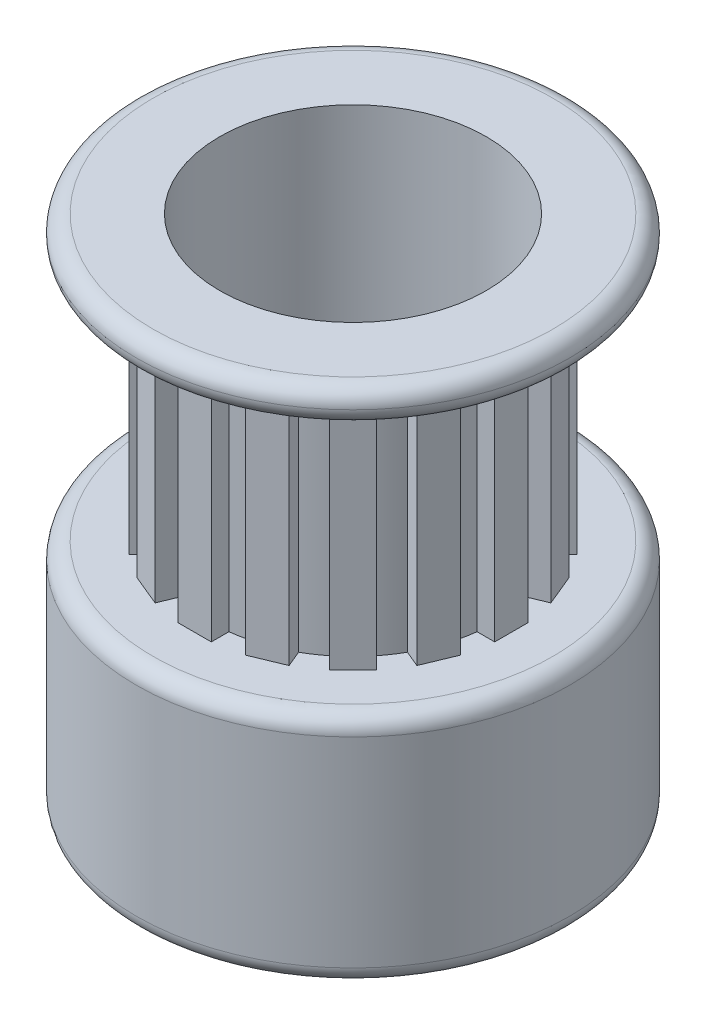
from build123d import *

# Parameters (mm, degrees)
SKETCH_3_R          = 4000
EXTRUDE_1_DEPTH     = 7500
SKETCH_4_R          = 6500
SKETCH_4_R_2        = 4000
EXTRUDE_2_DEPTH     = 1000
EXTRUDE_START       = 7000
SKETCH_5_R          = 6500
SKETCH_5_R_2        = 4000
EXTRUDE_3_DEPTH     = 7000
FILLET_1_R          = 500
FILLET_2_R          = 500
SKETCH_6_R          = 1500
CUT_EXTRUDE_1_DEPTH = 7000


with BuildPart() as part:
    # 草圖3 → 填料-伸長1 (new body)
    with BuildSketch(Plane(origin=(0, 0, 0), x_dir=(1, 0, 0), z_dir=(0, 1, 0))):
        with BuildLine():
            Line((1355.806537479, 4579.769495611), (1153.170208346, 4090.56212159))
            ThreePointArc((1153.170208346, 4090.56212159), (829.133868569, 4168.337441714), (500, 4220.485754034))
            Line((500, 4220.485754034), (500, 4750))
            Line((500, 4750), (-500, 4750))
            Line((-500, 4750), (-500, 4220.485754034))
            ThreePointArc((-500, 4220.485754034), (-829.133868569, 4168.337441714), (-1153.170208346, 4090.56212159))
            Line((-1153.170208346, 4090.56212159), (-1355.806537478, 4579.769495611))
            Line((-1355.806537478, 4579.769495611), (-2279.68606999, 4197.086063246))
            Line((-2279.68606999, 4197.086063246), (-2077.049740857, 3707.878689225))
            ThreePointArc((-2077.049740857, 3707.878689225), (-2361.173490333, 3533.745852286), (-2630.780705985, 3337.887487172))
            Line((-2630.780705985, 3337.887487172), (-3005.203820043, 3712.310601229))
            Line((-3005.203820043, 3712.310601229), (-3712.310601229, 3005.203820043))
            Line((-3712.310601229, 3005.203820043), (-3337.887487172, 2630.780705985))
            ThreePointArc((-3337.887487172, 2630.780705985), (-3533.745852286, 2361.173490333), (-3707.878689225, 2077.049740857))
            Line((-3707.878689225, 2077.049740857), (-4197.086063246, 2279.68606999))
            Line((-4197.086063246, 2279.68606999), (-4579.769495611, 1355.806537479))
            Line((-4579.769495611, 1355.806537479), (-4090.56212159, 1153.170208346))
            ThreePointArc((-4090.56212159, 1153.170208346), (-4168.337441714, 829.133868569), (-4220.485754034, 500))
            Line((-4220.485754034, 500), (-4750, 500))
            Line((-4750, 500), (-4750, -500))
            Line((-4750, -500), (-4220.485754034, -500))
            ThreePointArc((-4220.485754034, -500), (-4168.337441714, -829.133868569), (-4090.56212159, -1153.170208346))
            Line((-4090.56212159, -1153.170208346), (-4579.769495611, -1355.806537478))
            Line((-4579.769495611, -1355.806537478), (-4197.086063246, -2279.68606999))
            Line((-4197.086063246, -2279.68606999), (-3707.878689225, -2077.049740857))
            ThreePointArc((-3707.878689225, -2077.049740857), (-3533.745852286, -2361.173490333), (-3337.887487172, -2630.780705985))
            Line((-3337.887487172, -2630.780705985), (-3712.310601229, -3005.203820043))
            Line((-3712.310601229, -3005.203820043), (-3005.203820043, -3712.310601229))
            Line((-3005.203820043, -3712.310601229), (-2630.780705985, -3337.887487172))
            ThreePointArc((-2630.780705985, -3337.887487172), (-2361.173490333, -3533.745852286), (-2077.049740857, -3707.878689224))
            Line((-2077.049740857, -3707.878689224), (-2279.68606999, -4197.086063246))
            Line((-2279.68606999, -4197.086063246), (-1355.806537479, -4579.769495611))
            Line((-1355.806537479, -4579.769495611), (-1153.170208346, -4090.56212159))
            ThreePointArc((-1153.170208346, -4090.56212159), (-829.133868569, -4168.337441714), (-500, -4220.485754034))
            Line((-500, -4220.485754034), (-500, -4750))
            Line((-500, -4750), (500, -4750))
            Line((500, -4750), (500, -4220.485754034))
            ThreePointArc((500, -4220.485754034), (829.133868569, -4168.337441714), (1153.170208346, -4090.56212159))
            Line((1153.170208346, -4090.56212159), (1355.806537479, -4579.769495611))
            Line((1355.806537479, -4579.769495611), (2279.68606999, -4197.086063246))
            Line((2279.68606999, -4197.086063246), (2077.049740857, -3707.878689225))
            ThreePointArc((2077.049740857, -3707.878689225), (2361.173490333, -3533.745852286), (2630.780705985, -3337.887487172))
            Line((2630.780705985, -3337.887487172), (3005.203820043, -3712.310601229))
            Line((3005.203820043, -3712.310601229), (3712.310601229, -3005.203820043))
            Line((3712.310601229, -3005.203820043), (3337.887487172, -2630.780705985))
            ThreePointArc((3337.887487172, -2630.780705985), (3533.745852286, -2361.173490333), (3707.878689224, -2077.049740857))
            Line((3707.878689224, -2077.049740857), (4197.086063246, -2279.68606999))
            Line((4197.086063246, -2279.68606999), (4579.769495611, -1355.806537479))
            Line((4579.769495611, -1355.806537479), (4090.56212159, -1153.170208346))
            ThreePointArc((4090.56212159, -1153.170208346), (4168.337441714, -829.133868569), (4220.485754034, -500))
            Line((4220.485754034, -500), (4750, -500))
            Line((4750, -500), (4750, 500))
            Line((4750, 500), (4220.485754034, 500))
            ThreePointArc((4220.485754034, 500), (4168.337441714, 829.133868569), (4090.56212159, 1153.170208346))
            Line((4090.56212159, 1153.170208346), (4579.769495611, 1355.806537479))
            Line((4579.769495611, 1355.806537479), (4197.086063246, 2279.68606999))
            Line((4197.086063246, 2279.68606999), (3707.878689225, 2077.049740857))
            ThreePointArc((3707.878689225, 2077.049740857), (3533.745852286, 2361.173490333), (3337.887487172, 2630.780705985))
            Line((3337.887487172, 2630.780705985), (3712.310601229, 3005.203820043))
            Line((3712.310601229, 3005.203820043), (3005.203820043, 3712.310601229))
            Line((3005.203820043, 3712.310601229), (2630.780705985, 3337.887487172))
            ThreePointArc((2630.780705985, 3337.887487172), (2361.173490333, 3533.745852286), (2077.049740857, 3707.878689225))
            Line((2077.049740857, 3707.878689225), (2279.68606999, 4197.086063246))
            Line((2279.68606999, 4197.086063246), (1355.806537479, 4579.769495611))
        make_face()
        with Locations(Location((0, 0, 0), (0, 0, 270))):
            Circle(SKETCH_3_R, mode=Mode.SUBTRACT)
    extrude(amount=EXTRUDE_1_DEPTH)

    # 草圖4 → 填料-伸長2 (add)
    with BuildSketch(Plane(origin=(0, 7500, 0), x_dir=(1, 0, 0), z_dir=(0, 1, 0))):
        with Locations(Location((0, 0, 0), (0, 0, 270))):
            Circle(SKETCH_4_R)
        with Locations(Location((0, 0, 0), (0, 0, 270))):
            Circle(SKETCH_4_R_2, mode=Mode.SUBTRACT)
    extrude(amount=EXTRUDE_2_DEPTH)

    # 草圖5 → 填料-伸長3 (add)
    with BuildSketch(Plane.XZ.offset(EXTRUDE_START)):
        with Locations(Location((0, 0, 0), (0, 0, 90))):
            Circle(SKETCH_5_R)
        with Locations(Location((0, 0, 0), (0, 0, 270))):
            Circle(SKETCH_5_R_2, mode=Mode.SUBTRACT)
    extrude(amount=-EXTRUDE_3_DEPTH)

    # 圓角1
    fillet_1_edges = [part.edges().sort_by_distance(p)[0] for p in [
        (0, -7000, -6500),
        (0, 0, -6500),
    ]]
    fillet(fillet_1_edges, radius=FILLET_1_R)

    # 圓角2
    fillet_2_edges = [part.edges().sort_by_distance(p)[0] for p in [
        (0, 8500, -6500),
        (0, 7500, -6500),
    ]]
    fillet(fillet_2_edges, radius=FILLET_2_R - 0.0001)  # a hair under: the kernel refuses the full size

    # 草圖6 → 除料-伸長1 (cut)
    with BuildSketch(Plane(origin=(0, 0, 0), x_dir=(0, 0, -1), z_dir=(1, 0, 0))):
        with Locations((0, -3000)):
            Circle(SKETCH_6_R)
    extrude(amount=-CUT_EXTRUDE_1_DEPTH, mode=Mode.SUBTRACT)


solid = part.part
